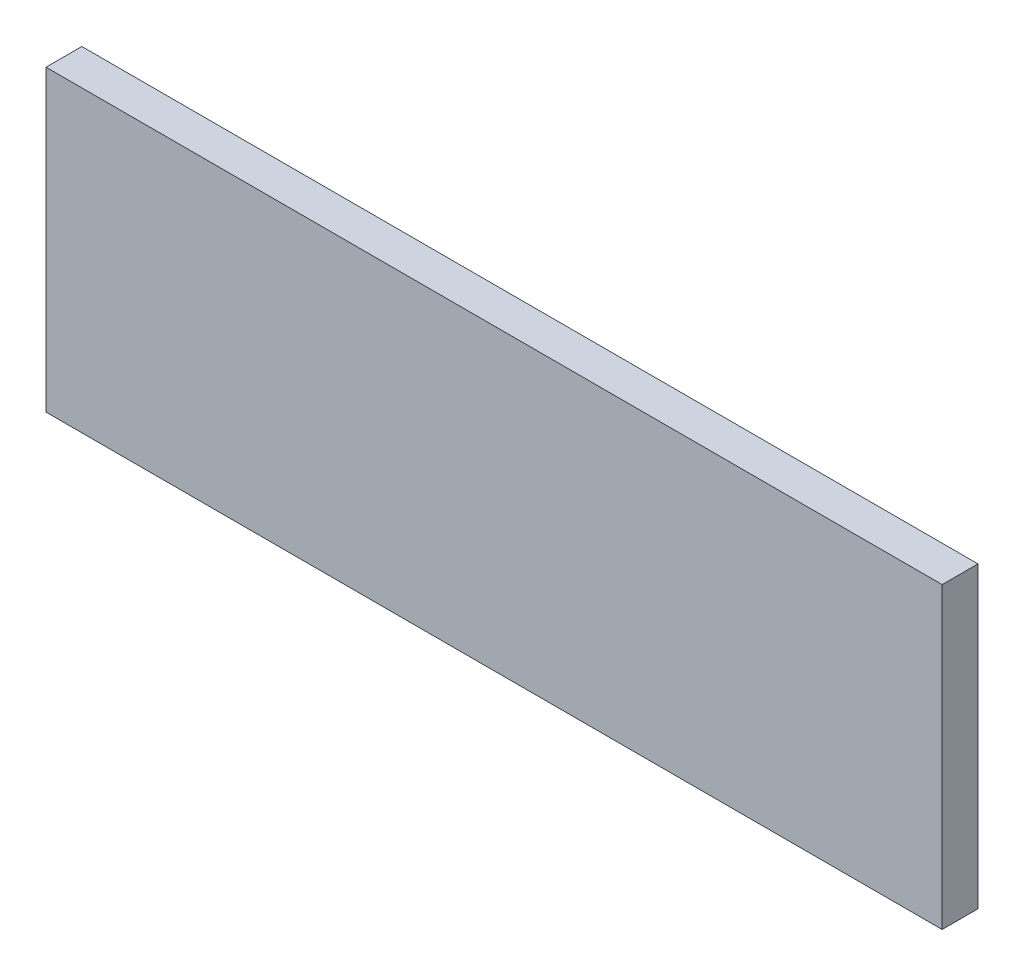
from build123d import *

# Parameters (mm, degrees)
IZIM1_W            = 300
IZIM1_H            = 100
TABAN_FLAN_1_DEPTH = 12


# Sheet-metal steps are written as plain solids
with BuildPart() as part:
    # Çizim1 → Taban-Flanş1 (new body)
    with BuildSketch(Plane.XY):
        with Locations((150, -50)):
            Rectangle(IZIM1_W, IZIM1_H)
    extrude(amount=-TABAN_FLAN_1_DEPTH)


solid = part.part
